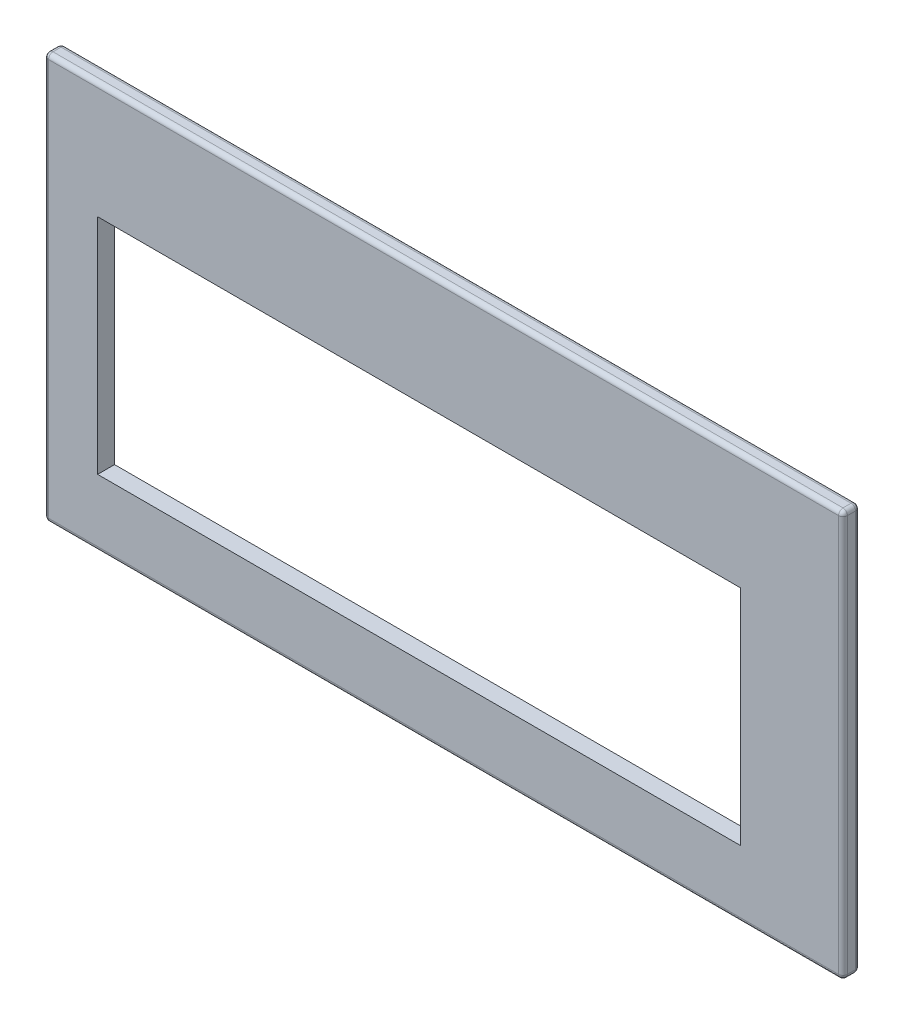
from build123d import *

# Parameters (mm, degrees)
SKETCH1_W               = 89.5
SKETCH1_H               = 45.5
BOSS_EXTRUDE1_DEPTH     = 1.9
FILLET1_R               = 0.5
FILLET2_R               = 0.5
CUT_EXTRUDE1_DEPTH      = 75.270166564
CUT_EXTRUDE1_DEPTH_BACK = 75.270166564
SKETCH2_W               = 72
SKETCH2_H               = 25


with BuildPart() as part:
    # Sketch1 → Boss-Extrude1 (new body)
    with BuildSketch(Plane.XY):
        with Locations((-22.362297468, -9.005112503)):
            Rectangle(SKETCH1_W, SKETCH1_H)
    extrude(amount=BOSS_EXTRUDE1_DEPTH)

    # Fillet1
    fillet1_edges = [part.edges().sort_by_distance(p)[0] for p in [
        (22.387702532, -9.005112503, 1.9),
        (-22.362297468, 13.744887497, 1.9),
        (-67.112297468, -9.005112503, 1.9),
        (-22.362297468, 13.744887497, 0),
        (22.387702532, -9.005112503, 0),
        (-67.112297468, -9.005112503, 0),
        (-67.112297468, 13.744887497, 0.95),
        (22.387702532, 13.744887497, 0.95),
        (22.387702532, -31.755112503, 0.95),
        (-67.112297468, -31.755112503, 0.95),
    ]]
    fillet(fillet1_edges, radius=FILLET1_R)

    # Fillet2
    # the kernel refuses this fillet: 0.5 mm, written as the material it takes off along each edge
    with BuildSketch(Plane(origin=(-66.612297468, -31.255112503, 1.4), x_dir=(0, -1, 0), z_dir=(0, 0, 1))) as fillet2_piece_1_section:
        Polygon((0, 0), (FILLET2_R, 0), (FILLET2_R, -FILLET2_R), (0, -FILLET2_R), align=None)
    fillet2_piece_1 = extrude(amount=FILLET2_R, mode=Mode.PRIVATE)
    fillet2_piece_1 = fillet2_piece_1 - Plane(origin=(-66.612297468, -31.255112503, 1.4), x_dir=(0.7071067811865475, 0.7071067811865477, 0), z_dir=(0, 0, 1)) * Sphere(FILLET2_R, mode=Mode.PRIVATE)
    add(fillet2_piece_1, mode=Mode.SUBTRACT)
    with BuildSketch(Plane(origin=(-66.612297468, -31.255112503, 0.5), x_dir=(0, -1, 0), z_dir=(0, 0, -1))) as fillet2_piece_2_section:
        Polygon((0, 0), (FILLET2_R, 0), (FILLET2_R, FILLET2_R), (0, FILLET2_R), align=None)
    fillet2_piece_2 = extrude(amount=FILLET2_R, mode=Mode.PRIVATE)
    fillet2_piece_2 = fillet2_piece_2 - Plane(origin=(-66.612297468, -31.255112503, 0.5), x_dir=(0.7071067811865475, 0.7071067811865477, 0), z_dir=(0, 0, -1)) * Sphere(FILLET2_R, mode=Mode.PRIVATE)
    add(fillet2_piece_2, mode=Mode.SUBTRACT)
    with BuildSketch(Plane(origin=(21.887702532, -31.255112503, 1.4), x_dir=(0, -1, 0), z_dir=(0, 0, 1))) as fillet2_piece_3_section:
        Polygon((0, 0), (FILLET2_R, 0), (FILLET2_R, FILLET2_R), (0, FILLET2_R), align=None)
    fillet2_piece_3 = extrude(amount=FILLET2_R, mode=Mode.PRIVATE)
    fillet2_piece_3 = fillet2_piece_3 - Plane(origin=(21.887702532, -31.255112503, 1.4), x_dir=(-0.7071067811865476, 0.7071067811865474, 0), z_dir=(0, 0, 1)) * Sphere(FILLET2_R, mode=Mode.PRIVATE)
    add(fillet2_piece_3, mode=Mode.SUBTRACT)
    with BuildSketch(Plane(origin=(21.887702532, -31.255112503, 0.5), x_dir=(0, -1, 0), z_dir=(0, 0, -1))) as fillet2_piece_4_section:
        Polygon((0, 0), (FILLET2_R, 0), (FILLET2_R, -FILLET2_R), (0, -FILLET2_R), align=None)
    fillet2_piece_4 = extrude(amount=FILLET2_R, mode=Mode.PRIVATE)
    fillet2_piece_4 = fillet2_piece_4 - Plane(origin=(21.887702532, -31.255112503, 0.5), x_dir=(-0.7071067811865476, 0.7071067811865474, 0), z_dir=(0, 0, -1)) * Sphere(FILLET2_R, mode=Mode.PRIVATE)
    add(fillet2_piece_4, mode=Mode.SUBTRACT)
    with BuildSketch(Plane(origin=(21.887702532, -31.755112503, 0), x_dir=(0, 1, 0), z_dir=(-1, 0, 0))) as fillet2_piece_5:
        with BuildLine():
            CenterArc((FILLET2_R, -FILLET2_R), FILLET2_R, 90, 90)
            Line((0, -FILLET2_R), (0, 0))
            Line((0, 0), (FILLET2_R, 0))
        make_face()
    extrude(amount=88.5, mode=Mode.SUBTRACT)
    with BuildSketch(Plane(origin=(21.887702532, -31.755112503, 1.9), x_dir=(0, 1, 0), z_dir=(-1, 0, 0))) as fillet2_piece_6:
        with BuildLine():
            CenterArc((FILLET2_R, FILLET2_R), FILLET2_R, 180, 90)
            Line((0, FILLET2_R), (0, 0))
            Line((0, 0), (FILLET2_R, 0))
        make_face()
    extrude(amount=88.5, mode=Mode.SUBTRACT)

    # Sketch2 → Cut-Extrude1 (cut, two sides: drawn at the far end of the back side and taken through both)
    with BuildSketch(Plane.XY.offset(1.9).offset(-CUT_EXTRUDE1_DEPTH_BACK)):
        with Locations((-25.112297468, -11.755112503)):
            Rectangle(SKETCH2_W, SKETCH2_H)
    extrude(amount=CUT_EXTRUDE1_DEPTH + CUT_EXTRUDE1_DEPTH_BACK, mode=Mode.SUBTRACT)


solid = part.part
